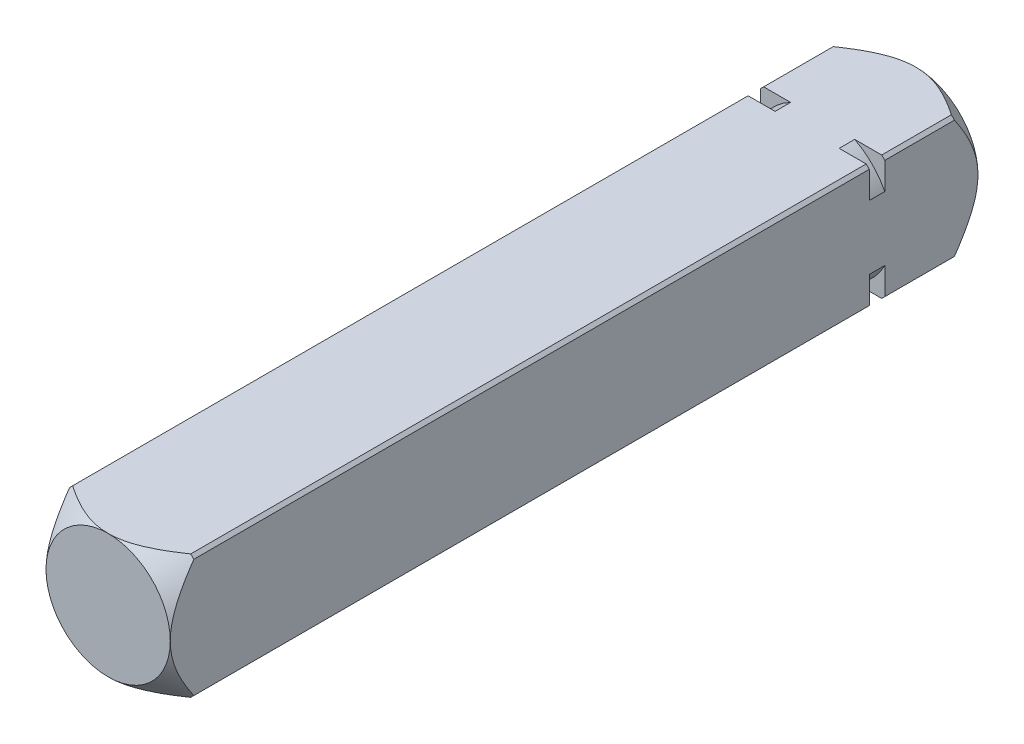
from build123d import *

# Parameters (mm, degrees)
ESQUISSE1_W             = 8
ESQUISSE1_H             = 8
BASE_EXTRUSION_DEPTH    = 52
CHANFREIN1_SIZE         = 0.2
ESQUISSE3_OUTSIDE_W     = 127.256
ESQUISSE3_OUTSIDE_H     = 127.256
ESQUISSE3_OUTSIDE_R     = 4
ENL_V_MAT_EXTRU_2_DEPTH = 53.306787345
ENL_V_MAT_EXTRU_2_DRAFT = -45
ESQUISSE5_OUTSIDE_W     = 20.644
ESQUISSE5_OUTSIDE_H     = 20.644
ESQUISSE5_OUTSIDE_R     = 4.5
ENL_V_MAT_EXTRU_4_DEPTH = 1


# Read off the part's stored shape, not the designer's step: Enlèv. mat.-Extru.1
with BuildPart() as part:
    # Esquisse1 → Base-Extrusion (new body)
    with BuildSketch(Plane.XY):
        Rectangle(ESQUISSE1_W, ESQUISSE1_H)
    extrude(amount=-BASE_EXTRUSION_DEPTH)

    # Enlèv. mat.-Extru.1 outline → Enlèv. mat.-Extru.1 (revolve, cut)
    with BuildSketch(Plane.XZ):
        Polygon((5.656854226, 2.3e-08), (3.999999988, 2.3e-08), (5.656854226, -1.656854226), align=None)
    revolve(axis=Axis((0, 0, 0), (0, 0, 1)), mode=Mode.SUBTRACT)

    # Chanfrein1
    chanfrein1_edges = [part.edges().sort_by_distance(p)[0] for p in [
        (-4, 4, -26.828427113),
        (4, 4, -26.828427113),
        (4, -4, -26.828427113),
        (-4, -4, -26.828427113),
    ]]
    chamfer(chanfrein1_edges, length=CHANFREIN1_SIZE)


with BuildPart() as enl_v_mat_extru_2_tool:
    # Esquisse3 outside → Enlèv. mat.-Extru.2 (with draft: the straight prism first)
    with BuildSketch(Plane(origin=(0, 0, -52), x_dir=(-1, 0, 0), z_dir=(0, 0, -1))):
        Rectangle(ESQUISSE3_OUTSIDE_W, ESQUISSE3_OUTSIDE_H)
        Circle(ESQUISSE3_OUTSIDE_R, mode=Mode.SUBTRACT)
    extrude(amount=-ENL_V_MAT_EXTRU_2_DEPTH)
    # Enlèv. mat.-Extru.2: the draft: its side faces are tilted about the plane it starts from
    enl_v_mat_extru_2_sides = [enl_v_mat_extru_2_tool.faces().sort_by_distance(p)[0] for p in [
        (0, -63.628, -25.346606327),
        (-63.628, 0, -25.346606327),
        (0, 63.628, -25.346606327),
        (63.628, 0, -25.346606327),
        (4, 0, -25.346606327),
    ]]
    draft(enl_v_mat_extru_2_sides, Plane(origin=(0, 0, -52), x_dir=(-1, 0, 0), z_dir=(0, 0, -1)), ENL_V_MAT_EXTRU_2_DRAFT)


with BuildPart() as part_1:
    add(part.part)

    # Enlèv. mat.-Extru.2: cut by enl_v_mat_extru_2_tool
    add(enl_v_mat_extru_2_tool.part, mode=Mode.SUBTRACT)

    # Esquisse5 outside → Enlèv. mat.-Extru.4 (cut)
    with BuildSketch(Plane(origin=(0, 0, -46), x_dir=(-1, 0, 0), z_dir=(0, 0, -1))):
        Rectangle(ESQUISSE5_OUTSIDE_W, ESQUISSE5_OUTSIDE_H)
        Circle(ESQUISSE5_OUTSIDE_R, mode=Mode.SUBTRACT)
    extrude(amount=-ENL_V_MAT_EXTRU_4_DEPTH, mode=Mode.SUBTRACT)


solid = part_1.part
